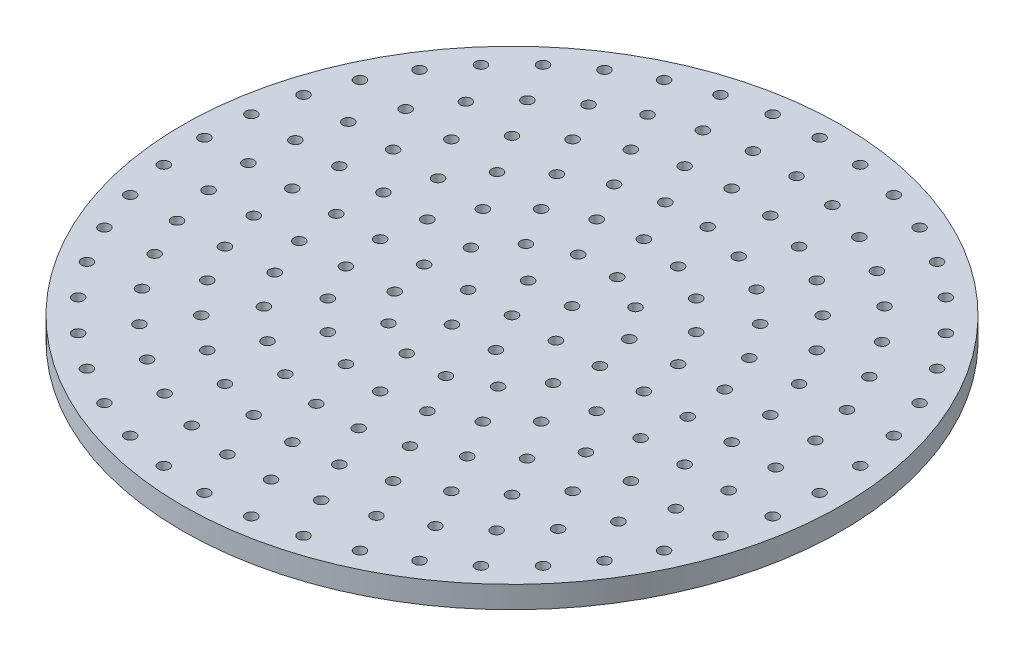
from build123d import *

# Parameters (mm, degrees)
SKETCH1_R               = 30
BOSS_EXTRUDE1_DEPTH     = 2
FILL_PATTERN1_OUTLINE_R = 0.5
FILL_PATTERN1_DEPTH     = 2


# Read off the part's stored shape, not the designer's step: Fill Pattern1
with BuildPart() as part:
    # Sketch1 → Boss-Extrude1 (new body)
    with BuildSketch(Plane(origin=(0, 0, 0), x_dir=(1, 0, 0), z_dir=(0, 1, 0))):
        with Locations(Location((0, 0, 0), (0, 0, 270))):
            Circle(SKETCH1_R)
    extrude(amount=BOSS_EXTRUDE1_DEPTH)

    # Fill Pattern1 outline → Fill Pattern1 (cut)
    with BuildSketch(Plane(origin=(0, 0, 0), x_dir=(1, 0, 0), z_dir=(0, 1, 0))):
        with Locations((0, 3.373e-06)):
            Circle(FILL_PATTERN1_OUTLINE_R)
        with Locations((-4, 3.373e-06)):
            Circle(FILL_PATTERN1_OUTLINE_R)
        with Locations((-8, 3.373e-06)):
            Circle(FILL_PATTERN1_OUTLINE_R)
        with Locations((-12, 3.373e-06)):
            Circle(FILL_PATTERN1_OUTLINE_R)
        with Locations((-16, 3.373e-06)):
            Circle(FILL_PATTERN1_OUTLINE_R)
        with Locations((-20, 3.373e-06)):
            Circle(FILL_PATTERN1_OUTLINE_R)
        with Locations((-24, 3.373e-06)):
            Circle(FILL_PATTERN1_OUTLINE_R)
        with Locations((-28, 3.373e-06)):
            Circle(FILL_PATTERN1_OUTLINE_R)
        with Locations((-2, 3.464104988)):
            Circle(FILL_PATTERN1_OUTLINE_R)
        with Locations((-7.207750943, 3.471073286)):
            Circle(FILL_PATTERN1_OUTLINE_R)
        with Locations((-11.412678196, 3.708207305)):
            Circle(FILL_PATTERN1_OUTLINE_R)
        with Locations((-15.535069079, 3.829054002)):
            Circle(FILL_PATTERN1_OUTLINE_R)
        with Locations((-19.615705608, 3.901809813)):
            Circle(FILL_PATTERN1_OUTLINE_R)
        with Locations((-23.672671282, 3.95027354)):
            Circle(FILL_PATTERN1_OUTLINE_R)
        with Locations((-27.715000373, 3.984818845)):
            Circle(FILL_PATTERN1_OUTLINE_R)
        with Locations((2, 3.464104988)):
            Circle(FILL_PATTERN1_OUTLINE_R)
        with Locations((-4.987918415, 6.254655233)):
            Circle(FILL_PATTERN1_OUTLINE_R)
        with Locations((-9.708203932, 7.0534264)):
            Circle(FILL_PATTERN1_OUTLINE_R)
        with Locations((-14.16729641, 7.435574126)):
            Circle(FILL_PATTERN1_OUTLINE_R)
        with Locations((-18.47759065, 7.65367202)):
            Circle(FILL_PATTERN1_OUTLINE_R)
        with Locations((-22.699613801, 7.792790634)):
            Circle(FILL_PATTERN1_OUTLINE_R)
        with Locations((-26.865803261, 7.888514964)):
            Circle(FILL_PATTERN1_OUTLINE_R)
        with Locations((4, 3.373e-06)):
            Circle(FILL_PATTERN1_OUTLINE_R)
        with Locations((-1.780167472, 7.79942667)):
            Circle(FILL_PATTERN1_OUTLINE_R)
        with Locations((-7.053423028, 9.708207305)):
            Circle(FILL_PATTERN1_OUTLINE_R)
        with Locations((-11.976171971, 10.609965905)):
            Circle(FILL_PATTERN1_OUTLINE_R)
        with Locations((-16.629392246, 11.111408033)):
            Circle(FILL_PATTERN1_OUTLINE_R)
        with Locations((-21.107370029, 11.422740806)):
            Circle(FILL_PATTERN1_OUTLINE_R)
        with Locations((-25.46969587, 11.631623737)):
            Circle(FILL_PATTERN1_OUTLINE_R)
        with Locations((2, -3.464098242)):
            Circle(FILL_PATTERN1_OUTLINE_R)
        with Locations((1.780167472, 7.79942667)):
            Circle(FILL_PATTERN1_OUTLINE_R)
        with Locations((-3.708203932, 11.412681568)):
            Circle(FILL_PATTERN1_OUTLINE_R)
        with Locations((-9.089035948, 13.167745227)):
            Circle(FILL_PATTERN1_OUTLINE_R)
        with Locations((-14.142135624, 14.142138997)):
            Circle(FILL_PATTERN1_OUTLINE_R)
        with Locations((-18.939372226, 14.741108477)):
            Circle(FILL_PATTERN1_OUTLINE_R)
        with Locations((-23.555098919, 15.137946262)):
            Circle(FILL_PATTERN1_OUTLINE_R)
        with Locations((-2, -3.464098242)):
            Circle(FILL_PATTERN1_OUTLINE_R)
        with Locations((4.987918415, 6.254655233)):
            Circle(FILL_PATTERN1_OUTLINE_R)
        with Locations((0, 12.000003373)):
            Circle(FILL_PATTERN1_OUTLINE_R)
        with Locations((-5.673678193, 14.960263256)):
            Circle(FILL_PATTERN1_OUTLINE_R)
        with Locations((-11.11140466, 16.629395619)):
            Circle(FILL_PATTERN1_OUTLINE_R)
        with Locations((-16.254757719, 17.657377229)):
            Circle(FILL_PATTERN1_OUTLINE_R)
        with Locations((-21.160988082, 18.336103923)):
            Circle(FILL_PATTERN1_OUTLINE_R)
        with Locations((7.207750943, 3.471073286)):
            Circle(FILL_PATTERN1_OUTLINE_R)
        with Locations((3.708203932, 11.412681568)):
            Circle(FILL_PATTERN1_OUTLINE_R)
        with Locations((-1.928586884, 15.883345358)):
            Circle(FILL_PATTERN1_OUTLINE_R)
        with Locations((-7.653668647, 18.477594023)):
            Circle(FILL_PATTERN1_OUTLINE_R)
        with Locations((-13.126755795, 20.091998851)):
            Circle(FILL_PATTERN1_OUTLINE_R)
        with Locations((-18.33610055, 21.160991455)):
            Circle(FILL_PATTERN1_OUTLINE_R)
        with Locations((8, 3.373e-06)):
            Circle(FILL_PATTERN1_OUTLINE_R)
        with Locations((7.053423028, 9.708207305)):
            Circle(FILL_PATTERN1_OUTLINE_R)
        with Locations((1.928586884, 15.883345358)):
            Circle(FILL_PATTERN1_OUTLINE_R)
        with Locations((-3.90180644, 19.615708981)):
            Circle(FILL_PATTERN1_OUTLINE_R)
        with Locations((-9.640690192, 21.978563213)):
            Circle(FILL_PATTERN1_OUTLINE_R)
        with Locations((-15.137942889, 23.555102292)):
            Circle(FILL_PATTERN1_OUTLINE_R)
        with Locations((7.207750943, -3.47106654)):
            Circle(FILL_PATTERN1_OUTLINE_R)
        with Locations((9.708203932, 7.0534264)):
            Circle(FILL_PATTERN1_OUTLINE_R)
        with Locations((5.673678193, 14.960263256)):
            Circle(FILL_PATTERN1_OUTLINE_R)
        with Locations((0, 20.000003373)):
            Circle(FILL_PATTERN1_OUTLINE_R)
        with Locations((-5.891651691, 23.265609755)):
            Circle(FILL_PATTERN1_OUTLINE_R)
        with Locations((-11.631620364, 25.469699243)):
            Circle(FILL_PATTERN1_OUTLINE_R)
        with Locations((4.987918415, -6.254648487)):
            Circle(FILL_PATTERN1_OUTLINE_R)
        with Locations((11.412678196, 3.708207305)):
            Circle(FILL_PATTERN1_OUTLINE_R)
        with Locations((9.089035948, 13.167745227)):
            Circle(FILL_PATTERN1_OUTLINE_R)
        with Locations((3.90180644, 19.615708981)):
            Circle(FILL_PATTERN1_OUTLINE_R)
        with Locations((-1.981904291, 23.918031205)):
            Circle(FILL_PATTERN1_OUTLINE_R)
        with Locations((-7.888511592, 26.865806634)):
            Circle(FILL_PATTERN1_OUTLINE_R)
        with Locations((1.780167472, -7.799419925)):
            Circle(FILL_PATTERN1_OUTLINE_R)
        with Locations((12, 3.373e-06)):
            Circle(FILL_PATTERN1_OUTLINE_R)
        with Locations((11.976171971, 10.609965905)):
            Circle(FILL_PATTERN1_OUTLINE_R)
        with Locations((7.653668647, 18.477594023)):
            Circle(FILL_PATTERN1_OUTLINE_R)
        with Locations((1.981904291, 23.918031205)):
            Circle(FILL_PATTERN1_OUTLINE_R)
        with Locations((-3.984815472, 27.715003746)):
            Circle(FILL_PATTERN1_OUTLINE_R)
        with Locations((-1.780167472, -7.799419925)):
            Circle(FILL_PATTERN1_OUTLINE_R)
        with Locations((11.412678196, -3.70820056)):
            Circle(FILL_PATTERN1_OUTLINE_R)
        with Locations((14.16729641, 7.435574126)):
            Circle(FILL_PATTERN1_OUTLINE_R)
        with Locations((11.11140466, 16.629395619)):
            Circle(FILL_PATTERN1_OUTLINE_R)
        with Locations((5.891651691, 23.265609755)):
            Circle(FILL_PATTERN1_OUTLINE_R)
        with Locations((0, 28.000003373)):
            Circle(FILL_PATTERN1_OUTLINE_R)
        with Locations((-4.987918415, -6.254648487)):
            Circle(FILL_PATTERN1_OUTLINE_R)
        with Locations((9.708203932, -7.053419655)):
            Circle(FILL_PATTERN1_OUTLINE_R)
        with Locations((15.535069079, 3.829054002)):
            Circle(FILL_PATTERN1_OUTLINE_R)
        with Locations((14.142135624, 14.142138997)):
            Circle(FILL_PATTERN1_OUTLINE_R)
        with Locations((9.640690192, 21.978563213)):
            Circle(FILL_PATTERN1_OUTLINE_R)
        with Locations((3.984815472, 27.715003746)):
            Circle(FILL_PATTERN1_OUTLINE_R)
        with Locations((-7.207750943, -3.47106654)):
            Circle(FILL_PATTERN1_OUTLINE_R)
        with Locations((7.053423028, -9.70820056)):
            Circle(FILL_PATTERN1_OUTLINE_R)
        with Locations((16, 3.373e-06)):
            Circle(FILL_PATTERN1_OUTLINE_R)
        with Locations((16.629392246, 11.111408033)):
            Circle(FILL_PATTERN1_OUTLINE_R)
        with Locations((13.126755795, 20.091998851)):
            Circle(FILL_PATTERN1_OUTLINE_R)
        with Locations((7.888511592, 26.865806634)):
            Circle(FILL_PATTERN1_OUTLINE_R)
        with Locations((3.708203932, -11.412674823)):
            Circle(FILL_PATTERN1_OUTLINE_R)
        with Locations((15.535069079, -3.829047256)):
            Circle(FILL_PATTERN1_OUTLINE_R)
        with Locations((18.47759065, 7.65367202)):
            Circle(FILL_PATTERN1_OUTLINE_R)
        with Locations((16.254757719, 17.657377229)):
            Circle(FILL_PATTERN1_OUTLINE_R)
        with Locations((11.631620364, 25.469699243)):
            Circle(FILL_PATTERN1_OUTLINE_R)
        with Locations((0, -11.999996627)):
            Circle(FILL_PATTERN1_OUTLINE_R)
        with Locations((14.16729641, -7.43556738)):
            Circle(FILL_PATTERN1_OUTLINE_R)
        with Locations((19.615705608, 3.901809813)):
            Circle(FILL_PATTERN1_OUTLINE_R)
        with Locations((18.939372226, 14.741108477)):
            Circle(FILL_PATTERN1_OUTLINE_R)
        with Locations((15.137942889, 23.555102292)):
            Circle(FILL_PATTERN1_OUTLINE_R)
        with Locations((-3.708203932, -11.412674823)):
            Circle(FILL_PATTERN1_OUTLINE_R)
        with Locations((11.976171971, -10.609959159)):
            Circle(FILL_PATTERN1_OUTLINE_R)
        with Locations((20, 3.373e-06)):
            Circle(FILL_PATTERN1_OUTLINE_R)
        with Locations((21.107370029, 11.422740806)):
            Circle(FILL_PATTERN1_OUTLINE_R)
        with Locations((18.33610055, 21.160991455)):
            Circle(FILL_PATTERN1_OUTLINE_R)
        with Locations((-7.053423028, -9.70820056)):
            Circle(FILL_PATTERN1_OUTLINE_R)
        with Locations((9.089035948, -13.167738481)):
            Circle(FILL_PATTERN1_OUTLINE_R)
        with Locations((19.615705608, -3.901803067)):
            Circle(FILL_PATTERN1_OUTLINE_R)
        with Locations((22.699613801, 7.792790634)):
            Circle(FILL_PATTERN1_OUTLINE_R)
        with Locations((21.160988082, 18.336103923)):
            Circle(FILL_PATTERN1_OUTLINE_R)
        with Locations((-9.708203932, -7.053419655)):
            Circle(FILL_PATTERN1_OUTLINE_R)
        with Locations((5.673678193, -14.96025651)):
            Circle(FILL_PATTERN1_OUTLINE_R)
        with Locations((18.47759065, -7.653665274)):
            Circle(FILL_PATTERN1_OUTLINE_R)
        with Locations((23.672671282, 3.95027354)):
            Circle(FILL_PATTERN1_OUTLINE_R)
        with Locations((23.555098919, 15.137946262)):
            Circle(FILL_PATTERN1_OUTLINE_R)
        with Locations((-11.412678196, -3.70820056)):
            Circle(FILL_PATTERN1_OUTLINE_R)
        with Locations((1.928586884, -15.883338613)):
            Circle(FILL_PATTERN1_OUTLINE_R)
        with Locations((16.629392246, -11.111401287)):
            Circle(FILL_PATTERN1_OUTLINE_R)
        with Locations((24, 3.373e-06)):
            Circle(FILL_PATTERN1_OUTLINE_R)
        with Locations((25.46969587, 11.631623737)):
            Circle(FILL_PATTERN1_OUTLINE_R)
        with Locations((-1.928586884, -15.883338613)):
            Circle(FILL_PATTERN1_OUTLINE_R)
        with Locations((14.142135624, -14.142132251)):
            Circle(FILL_PATTERN1_OUTLINE_R)
        with Locations((23.672671282, -3.950266794)):
            Circle(FILL_PATTERN1_OUTLINE_R)
        with Locations((26.865803261, 7.888514964)):
            Circle(FILL_PATTERN1_OUTLINE_R)
        with Locations((-5.673678193, -14.96025651)):
            Circle(FILL_PATTERN1_OUTLINE_R)
        with Locations((11.11140466, -16.629388873)):
            Circle(FILL_PATTERN1_OUTLINE_R)
        with Locations((22.699613801, -7.792783888)):
            Circle(FILL_PATTERN1_OUTLINE_R)
        with Locations((27.715000373, 3.984818845)):
            Circle(FILL_PATTERN1_OUTLINE_R)
        with Locations((-9.089035948, -13.167738481)):
            Circle(FILL_PATTERN1_OUTLINE_R)
        with Locations((7.653668647, -18.477587277)):
            Circle(FILL_PATTERN1_OUTLINE_R)
        with Locations((21.107370029, -11.42273406)):
            Circle(FILL_PATTERN1_OUTLINE_R)
        with Locations((28, 3.373e-06)):
            Circle(FILL_PATTERN1_OUTLINE_R)
        with Locations((-11.976171971, -10.609959159)):
            Circle(FILL_PATTERN1_OUTLINE_R)
        with Locations((3.90180644, -19.615702235)):
            Circle(FILL_PATTERN1_OUTLINE_R)
        with Locations((18.939372226, -14.741101732)):
            Circle(FILL_PATTERN1_OUTLINE_R)
        with Locations((27.715000373, -3.984812099)):
            Circle(FILL_PATTERN1_OUTLINE_R)
        with Locations((-14.16729641, -7.43556738)):
            Circle(FILL_PATTERN1_OUTLINE_R)
        with Locations((0, -19.999996627)):
            Circle(FILL_PATTERN1_OUTLINE_R)
        with Locations((16.254757719, -17.657370483)):
            Circle(FILL_PATTERN1_OUTLINE_R)
        with Locations((26.865803261, -7.888508219)):
            Circle(FILL_PATTERN1_OUTLINE_R)
        with Locations((-15.535069079, -3.829047256)):
            Circle(FILL_PATTERN1_OUTLINE_R)
        with Locations((-3.90180644, -19.615702235)):
            Circle(FILL_PATTERN1_OUTLINE_R)
        with Locations((13.126755795, -20.091992105)):
            Circle(FILL_PATTERN1_OUTLINE_R)
        with Locations((25.46969587, -11.631616991)):
            Circle(FILL_PATTERN1_OUTLINE_R)
        with Locations((-7.653668647, -18.477587277)):
            Circle(FILL_PATTERN1_OUTLINE_R)
        with Locations((9.640690192, -21.978556467)):
            Circle(FILL_PATTERN1_OUTLINE_R)
        with Locations((23.555098919, -15.137939516)):
            Circle(FILL_PATTERN1_OUTLINE_R)
        with Locations((-11.11140466, -16.629388873)):
            Circle(FILL_PATTERN1_OUTLINE_R)
        with Locations((5.891651691, -23.26560301)):
            Circle(FILL_PATTERN1_OUTLINE_R)
        with Locations((21.160988082, -18.336097178)):
            Circle(FILL_PATTERN1_OUTLINE_R)
        with Locations((-14.142135624, -14.142132251)):
            Circle(FILL_PATTERN1_OUTLINE_R)
        with Locations((1.981904291, -23.918024459)):
            Circle(FILL_PATTERN1_OUTLINE_R)
        with Locations((18.33610055, -21.160984709)):
            Circle(FILL_PATTERN1_OUTLINE_R)
        with Locations((-16.629392246, -11.111401287)):
            Circle(FILL_PATTERN1_OUTLINE_R)
        with Locations((-1.981904291, -23.918024459)):
            Circle(FILL_PATTERN1_OUTLINE_R)
        with Locations((15.137942889, -23.555095546)):
            Circle(FILL_PATTERN1_OUTLINE_R)
        with Locations((-18.47759065, -7.653665274)):
            Circle(FILL_PATTERN1_OUTLINE_R)
        with Locations((-5.891651691, -23.26560301)):
            Circle(FILL_PATTERN1_OUTLINE_R)
        with Locations((11.631620364, -25.469692497)):
            Circle(FILL_PATTERN1_OUTLINE_R)
        with Locations((-19.615705608, -3.901803067)):
            Circle(FILL_PATTERN1_OUTLINE_R)
        with Locations((-9.640690192, -21.978556467)):
            Circle(FILL_PATTERN1_OUTLINE_R)
        with Locations((7.888511592, -26.865799888)):
            Circle(FILL_PATTERN1_OUTLINE_R)
        with Locations((-13.126755795, -20.091992105)):
            Circle(FILL_PATTERN1_OUTLINE_R)
        with Locations((3.984815472, -27.714997)):
            Circle(FILL_PATTERN1_OUTLINE_R)
        with Locations((-16.254757719, -17.657370483)):
            Circle(FILL_PATTERN1_OUTLINE_R)
        with Locations((0, -27.999996627)):
            Circle(FILL_PATTERN1_OUTLINE_R)
        with Locations((-18.939372226, -14.741101732)):
            Circle(FILL_PATTERN1_OUTLINE_R)
        with Locations((-3.984815472, -27.714997)):
            Circle(FILL_PATTERN1_OUTLINE_R)
        with Locations((-21.107370029, -11.42273406)):
            Circle(FILL_PATTERN1_OUTLINE_R)
        with Locations((-7.888511592, -26.865799888)):
            Circle(FILL_PATTERN1_OUTLINE_R)
        with Locations((-22.699613801, -7.792783888)):
            Circle(FILL_PATTERN1_OUTLINE_R)
        with Locations((-11.631620364, -25.469692497)):
            Circle(FILL_PATTERN1_OUTLINE_R)
        with Locations((-23.672671282, -3.950266794)):
            Circle(FILL_PATTERN1_OUTLINE_R)
        with Locations((-15.137942889, -23.555095546)):
            Circle(FILL_PATTERN1_OUTLINE_R)
        with Locations((-18.33610055, -21.160984709)):
            Circle(FILL_PATTERN1_OUTLINE_R)
        with Locations((-21.160988082, -18.336097178)):
            Circle(FILL_PATTERN1_OUTLINE_R)
        with Locations((-23.555098919, -15.137939516)):
            Circle(FILL_PATTERN1_OUTLINE_R)
        with Locations((-25.46969587, -11.631616991)):
            Circle(FILL_PATTERN1_OUTLINE_R)
        with Locations((-26.865803261, -7.888508219)):
            Circle(FILL_PATTERN1_OUTLINE_R)
        with Locations((-27.715000373, -3.984812099)):
            Circle(FILL_PATTERN1_OUTLINE_R)
    extrude(amount=FILL_PATTERN1_DEPTH, mode=Mode.SUBTRACT)


solid = part.part
